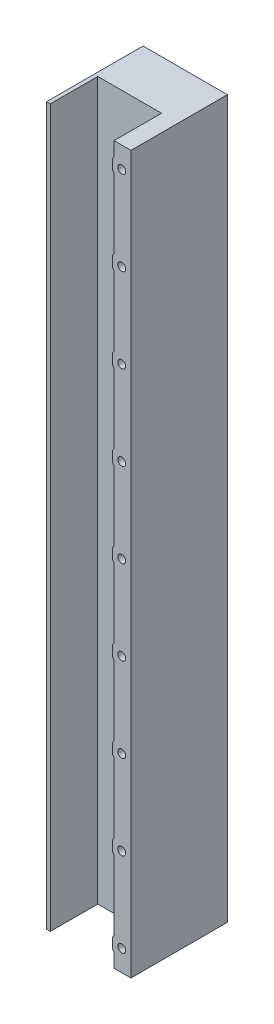
from build123d import *

# Parameters (mm, degrees)
PROFILE_SKETCH_W               = 16
PROFILE_SKETCH_H               = 18.3
PROFILE_EXTRUDE_DEPTH          = 136
POCKET_SKETCH_W                = 12.1
POCKET_SKETCH_H                = 9
POCKET_CUT_DEPTH               = 139.155311154
INDEX_HOLE_SKETCH_R            = 0.75
FIRST_INDEX_HOLE_CUT_DEPTH     = 8
INDEX_HOLE_REINFORCEMENT_REACH = 140.155
INDEX_HOLE_PATTERN_COUNT       = 9
INDEX_HOLE_PATTERN_PITCH       = 16


with BuildPart() as part:
    # Profile Sketch → Profile Extrude (new body)
    with BuildSketch(Plane(origin=(0.045617437, 0, -0.024209872), x_dir=(-1, 0, 0), z_dir=(0, 1, 0))):
        with Locations((8.045617437, -9.125790128)):
            Rectangle(PROFILE_SKETCH_W, PROFILE_SKETCH_H)
    extrude(amount=PROFILE_EXTRUDE_DEPTH)

    # Pocket Sketch → Pocket Cut (cut, through all)
    with BuildSketch(Plane(origin=(0, 0, 0), x_dir=(1, 0, 0), z_dir=(0, 1, 0))):
        with Locations((-9.25, 4.5)):
            Rectangle(POCKET_SKETCH_W, POCKET_SKETCH_H)
    extrude(amount=POCKET_CUT_DEPTH, mode=Mode.SUBTRACT)

    # Index Hole Sketch → First Index Hole Cut (cut)
    with BuildSketch(Plane.XY):
        with Locations((-1.75, 4)):
            Circle(INDEX_HOLE_SKETCH_R)
    first_index_hole_cut = extrude(amount=-FIRST_INDEX_HOLE_CUT_DEPTH, mode=Mode.SUBTRACT)

    # Index Hole Reinforcement Sketch → Index Hole Reinforcement (add, up to next)
    with BuildSketch(Plane.XY, mode=Mode.PRIVATE) as index_hole_reinforcement_sk1:
        with BuildLine():
            Line((-3.5, 4.968245837), (-3.5, 3.031754163))
            ThreePointArc((-3.5, 3.031754163), (-3.363031859, 2.817575279), (-3.2, 2.622502269))
            Line((-3.2, 2.622502269), (-3.2, 5.377497731))
            ThreePointArc((-3.2, 5.377497731), (-3.363031859, 5.182424721), (-3.5, 4.968245837))
        make_face()
    index_hole_reinforcement_tool1 = extrude(index_hole_reinforcement_sk1.sketch, amount=-INDEX_HOLE_REINFORCEMENT_REACH, mode=Mode.PRIVATE) - part.part
    index_hole_reinforcement = index_hole_reinforcement_tool1.solids().sort_by_distance((-3.34149, 4, 0))[0]
    add(index_hole_reinforcement)

    # Index Hole Pattern: First Index Hole Cut, Index Hole Reinforcement ×9
    with Locations(*[(0, i * INDEX_HOLE_PATTERN_PITCH, 0) for i in range(1, INDEX_HOLE_PATTERN_COUNT)]):
        add(first_index_hole_cut, mode=Mode.SUBTRACT)
        add(index_hole_reinforcement)


solid = part.part
